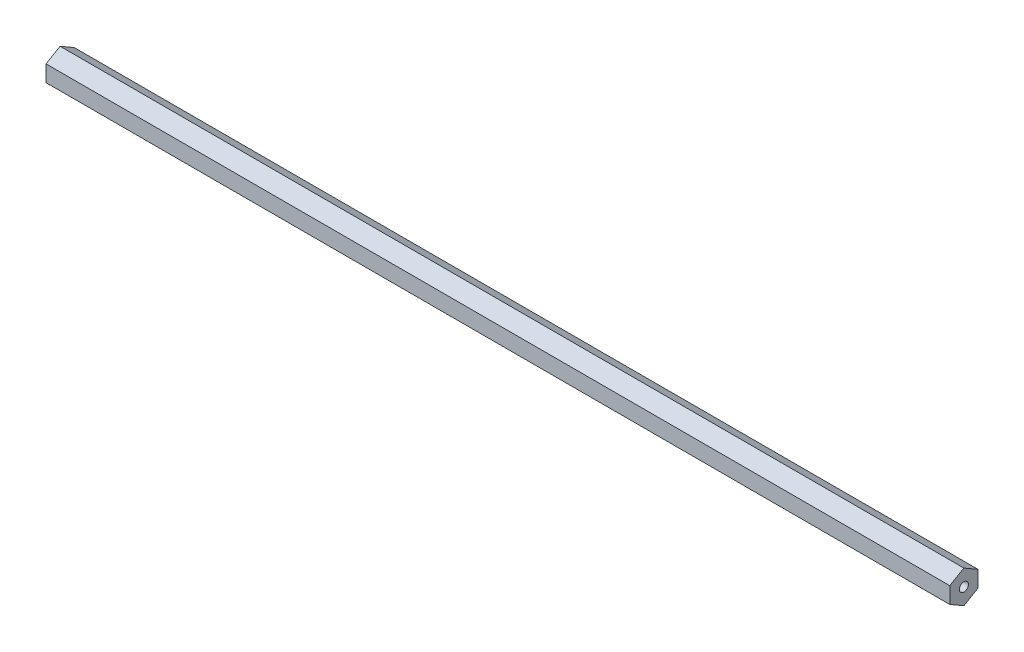
from build123d import *

# Parameters (mm, degrees)
BOSS_EXTRUDE1_DEPTH                  = 203.2
F_10_32_TAPPED_HOLE1_D               = 4.0386
F_10_32_TAPPED_HOLE1_DEPTH           = 16.34744
F_10_32_TAPPED_HOLE1_TIP             = 1.213317848
F_10_32_TAPPED_HOLE1_ON_FACE_2_D     = 4.0386
F_10_32_TAPPED_HOLE1_ON_FACE_2_DEPTH = 16.34744
F_10_32_TAPPED_HOLE1_ON_FACE_2_TIP   = 1.213317848


with BuildPart() as part:
    # Sketch1 → Boss-Extrude1 (new, symmetric)
    with BuildSketch(Plane(origin=(0, 0, 0), x_dir=(0, 0, -1), z_dir=(1, 0, 0))):
        Polygon((6.35, 3.666174209), (0, 7.332348419), (-6.35, 3.666174209), (-6.35, -3.666174209), (0, -7.332348419), (6.35, -3.666174209), align=None)
    extrude(amount=BOSS_EXTRUDE1_DEPTH, both=True)

    # #10-32 Tapped Hole1
    with Locations(Plane(origin=(203.2, 0, 0), x_dir=(0, 0, 1), z_dir=(1, 0, 0))):
        with Locations((0, 0)):
            Hole(F_10_32_TAPPED_HOLE1_D / 2, depth=F_10_32_TAPPED_HOLE1_DEPTH)
            with Locations((0, 0, -(F_10_32_TAPPED_HOLE1_DEPTH + F_10_32_TAPPED_HOLE1_TIP / 2))):  # 118° drill point
                Cone(0, F_10_32_TAPPED_HOLE1_D / 2, F_10_32_TAPPED_HOLE1_TIP, mode=Mode.SUBTRACT)

    # #10-32 Tapped Hole1 on face 2
    with Locations(Plane(origin=(-203.2, 0, 0), x_dir=(0, 0, -1), z_dir=(-1, 0, 0))):
        with Locations((0, 0)):
            Hole(F_10_32_TAPPED_HOLE1_ON_FACE_2_D / 2, depth=F_10_32_TAPPED_HOLE1_ON_FACE_2_DEPTH)
            with Locations((0, 0, -(F_10_32_TAPPED_HOLE1_ON_FACE_2_DEPTH + F_10_32_TAPPED_HOLE1_ON_FACE_2_TIP / 2))):  # 118° drill point
                Cone(0, F_10_32_TAPPED_HOLE1_ON_FACE_2_D / 2, F_10_32_TAPPED_HOLE1_ON_FACE_2_TIP, mode=Mode.SUBTRACT)


solid = part.part
